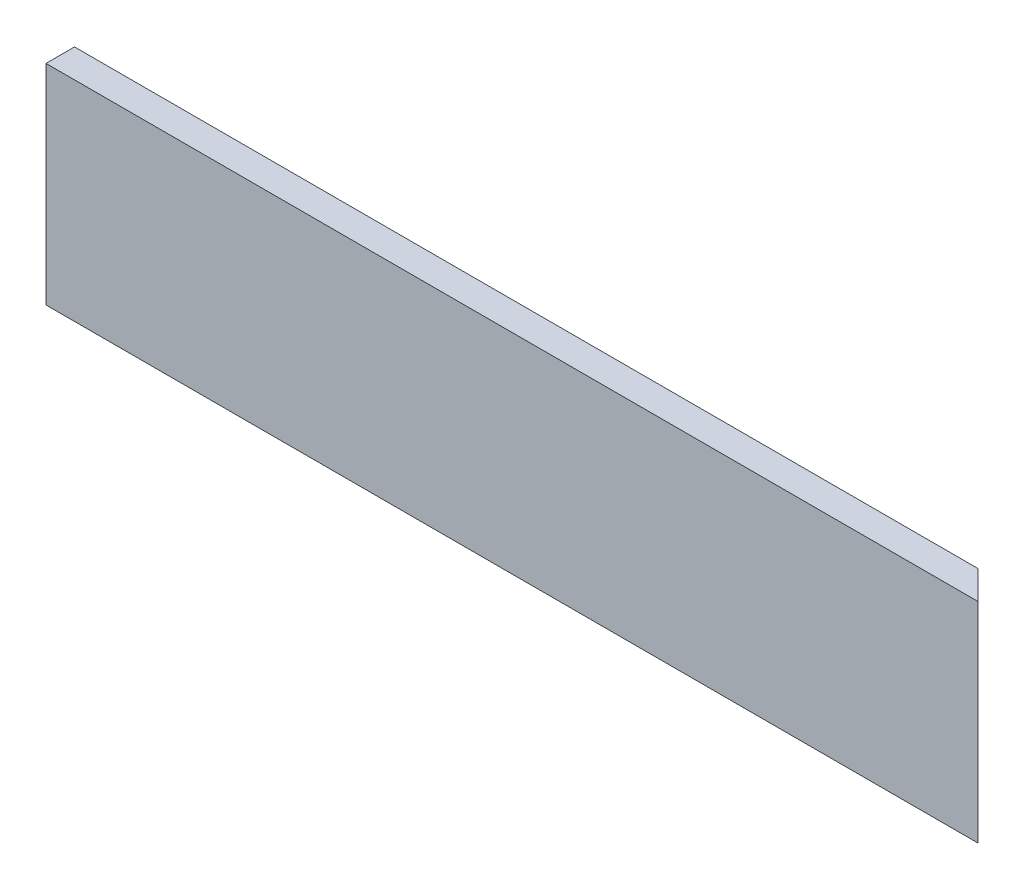
from build123d import *

# Parameters (mm, degrees)
SKETCH1_W           = 588
SKETCH1_H           = 132
BOSS_EXTRUDE1_DEPTH = 18
CHAMFER2_START      = 403.050865276
CHAMFER2_OUTLINE_W  = 28
CHAMFER2_OUTLINE_H  = 134
CHAMFER2_DEPTH      = 13.949134724


with BuildPart() as part:
    # Sketch1 → Boss-Extrude1 (new body)
    with BuildSketch(Plane.XY):
        with Locations((294, 66)):
            Rectangle(SKETCH1_W, SKETCH1_H)
    extrude(amount=BOSS_EXTRUDE1_DEPTH)

    # Chamfer2: read off the stored shape, not the designer's step
    # Chamfer2 outline → Chamfer2 (cut)
    with BuildSketch(Plane(origin=(0, 0, 0), x_dir=(0.7071067811865474, 0, 0.7071067811865477), z_dir=(0.7071067811865476, 0, -0.7071067811865476)).offset(CHAMFER2_START)):
        with Locations((416, -66)):
            Rectangle(CHAMFER2_OUTLINE_W, CHAMFER2_OUTLINE_H)
    extrude(amount=CHAMFER2_DEPTH, mode=Mode.SUBTRACT)


solid = part.part
